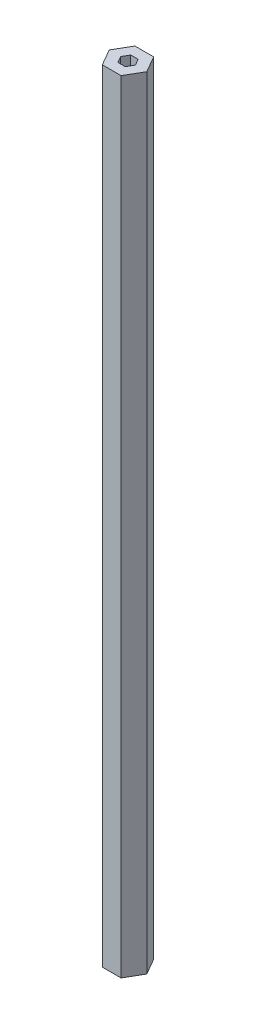
from build123d import *

# Parameters (mm, degrees)
BOSS_EXTRUDE1_DEPTH = 304.8


with BuildPart() as part:
    # Sketch1 → Boss-Extrude1 (new body)
    with BuildSketch(Plane(origin=(0, 0, 0), x_dir=(1, 0, 0), z_dir=(0, 1, 0))):
        Polygon((7.332348419, 0), (3.666174209, 6.35), (-3.666174209, 6.35), (-7.332348419, 0), (-3.666174209, -6.35), (3.666174209, -6.35), align=None)
        Polygon((1.443375673, 2.5), (-1.443375673, 2.5), (-2.886751346, 0), (-1.443375673, -2.5), (1.443375673, -2.5), (2.886751346, 0), align=None, mode=Mode.SUBTRACT)
    extrude(amount=BOSS_EXTRUDE1_DEPTH)


solid = part.part
